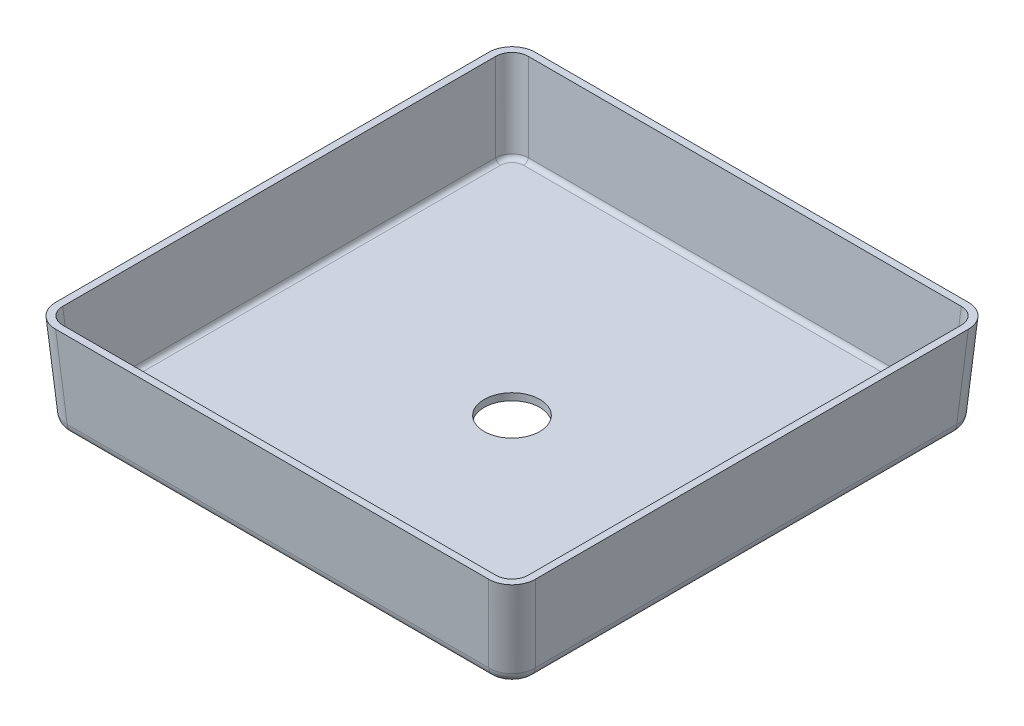
from build123d import *

# Parameters (mm, degrees)
CROQUIS1_W     = 200
CROQUIS1_H     = 200
EXTRUIR1_DEPTH = 40
EXTRUIR1_DRAFT = -4
REDONDEO1_R    = 10
REDONDEO2_R    = 5
VACIADO1_T     = -3
CROQUIS2_R     = 11.926621578
EXTRUIR2_DEPTH = 151.011587114


with BuildPart() as part:
    # Croquis1 → Extruir1 (with draft: the straight prism first)
    with BuildSketch(Plane(origin=(0, 0, 0), x_dir=(1, 0, 0), z_dir=(0, 1, 0))):
        Rectangle(CROQUIS1_W, CROQUIS1_H)
    extrude(amount=EXTRUIR1_DEPTH)
    # Extruir1: the draft: its side faces are tilted about the plane it starts from
    extruir1_sides = [part.faces().sort_by_distance(p)[0] for p in [
        (100, 20, 0),
        (0, 20, -100),
        (-100, 20, 0),
        (0, 20, 100),
    ]]
    draft(extruir1_sides, Plane(origin=(0, 0, 0), x_dir=(1, 0, 0), z_dir=(0, 1, 0)), EXTRUIR1_DRAFT)

    # Redondeo1
    redondeo1_edges = [part.edges().sort_by_distance(p)[0] for p in [
        (-101.398536239, 20, 101.398536239),
        (-101.398536239, 20, -101.398536239),
        (101.398536239, 20, 101.398536239),
        (101.398536239, 20, -101.398536239),
    ]]
    fillet(redondeo1_edges, radius=REDONDEO1_R)

    # Redondeo2
    redondeo2_edges = [part.edges().sort_by_distance(p)[0] for p in [
        (97.081140526, 0, 97.081140526),
        (100, 0, 0),
        (97.081140526, 0, -97.081140526),
        (0, 0, -100),
        (-97.081140526, 0, -97.081140526),
        (-100, 0, 0),
        (-97.081140526, 0, 97.081140526),
        (0, 0, 100),
    ]]
    fillet(redondeo2_edges, radius=REDONDEO2_R)

    # Vaciado1
    vaciado1_openings = [part.faces().sort_by_distance(p)[0] for p in [
        (0, 40, 0),
    ]]
    offset(amount=VACIADO1_T, openings=vaciado1_openings, kind=Kind.INTERSECTION)

    # Croquis2 → Extruir2 (cut, through all)
    with BuildSketch(Plane(origin=(0, 3, 0), x_dir=(1, 0, 0), z_dir=(0, 1, 0))):
        Circle(CROQUIS2_R)
    extrude(amount=-EXTRUIR2_DEPTH, mode=Mode.SUBTRACT)


solid = part.part
